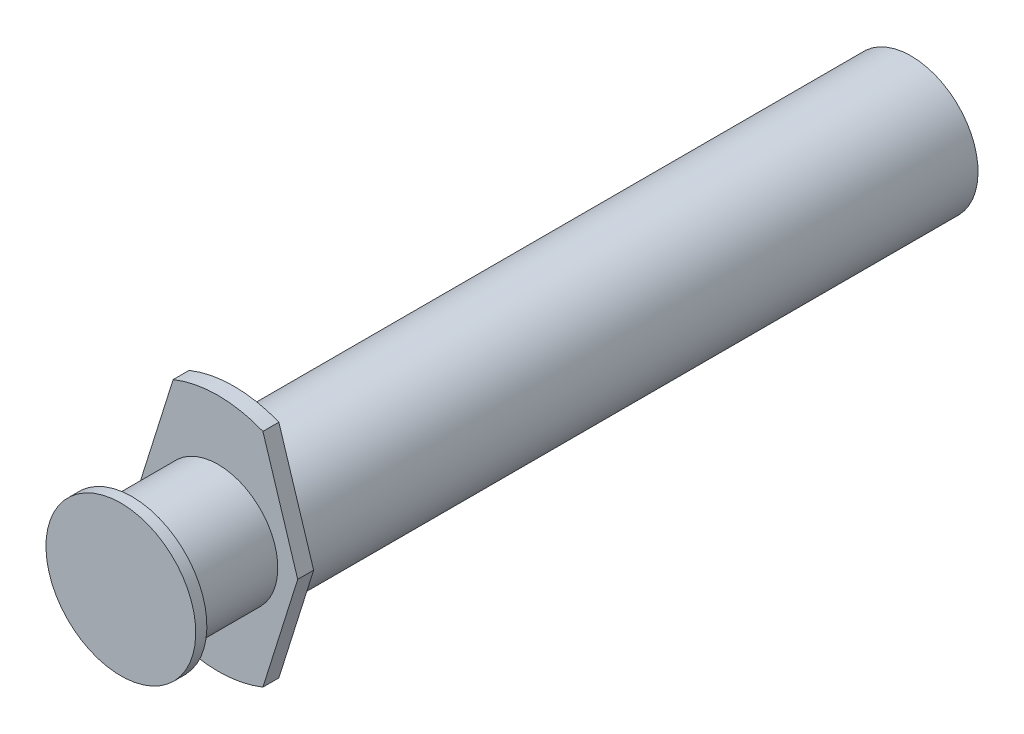
from build123d import *

# Parameters (mm, degrees)
CORTAR_EXTRUIR1_START = -2.54
CORTAR_EXTRUIR1_DEPTH = 2.54


# Read off the part's stored shape, not the designer's step: Cortar-Extruir1
with BuildPart() as part:
    # Croquis1 → Revolución1 (revolve)
    with BuildSketch(Plane(origin=(0, 0, 0), x_dir=(0, 0, -1), z_dir=(1, 0, 0))):
        Polygon((0, 0), (0, 11.938), (1.778, 11.938), (1.778, 9.525), (15.494, 9.525), (15.494, 19.05), (18.034, 19.05), (18.034, 10.668), (125.984, 10.668), (125.984, 0), align=None)
    revolve(axis=Axis((0, 0, -125.984), (0, 0, 1)))

    # Cortar-Extruir1 outline → Cortar-Extruir1 (cut)
    with BuildSketch(Plane.XY.offset(-15.494).offset(CORTAR_EXTRUIR1_START)):
        with BuildLine():
            Line((-7.156259894, -17.654756989), (-12.7, 0))
            Line((-12.7, 0), (-7.156259894, 17.654756989))
            ThreePointArc((-7.156259894, 17.654756989), (-19.05, 0), (-7.156259894, -17.654756989))
        make_face()
        with BuildLine():
            Line((12.7, 0), (7.156259894, -17.654756989))
            ThreePointArc((7.156259894, -17.654756989), (19.05, 0), (7.156259894, 17.654756989))
            Line((7.156259894, 17.654756989), (12.7, 0))
        make_face()
    extrude(amount=CORTAR_EXTRUIR1_DEPTH, mode=Mode.SUBTRACT)


solid = part.part
